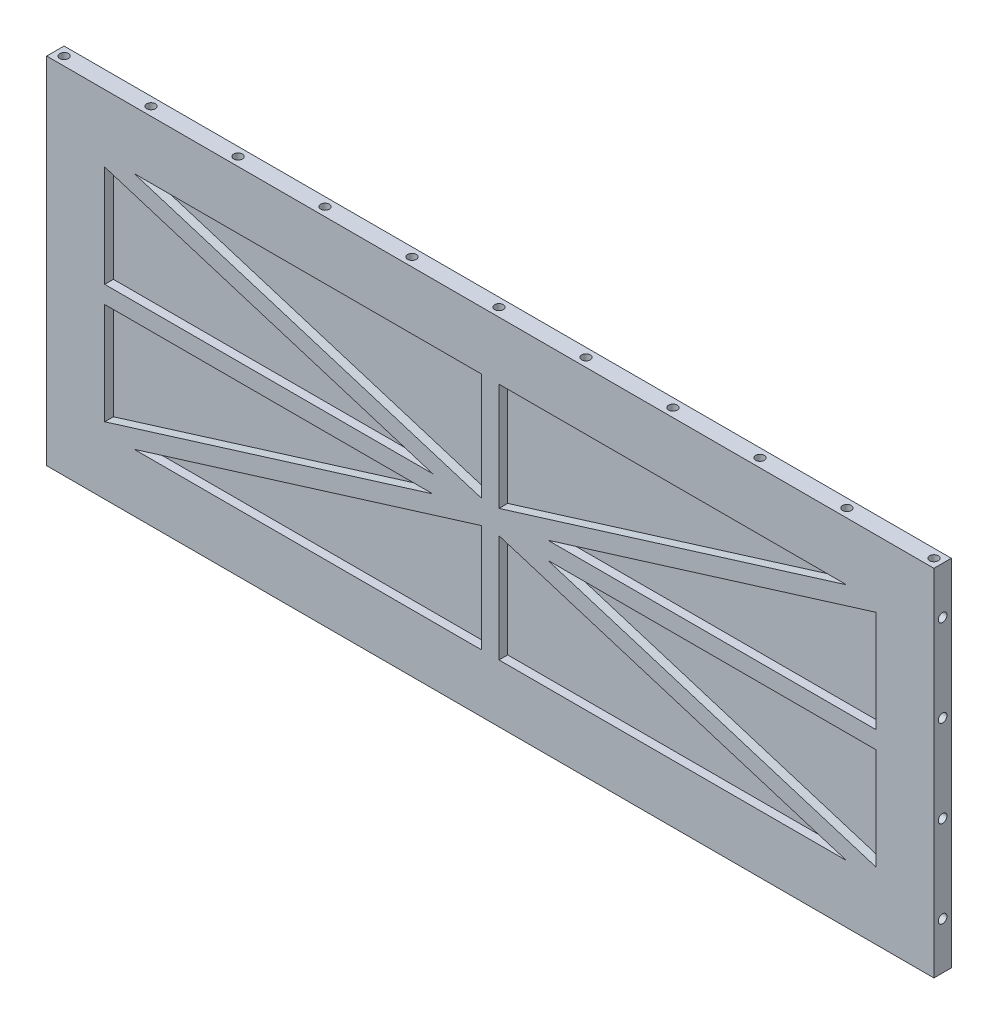
from build123d import *

# Parameters (mm, degrees)
SKETCH_1_W                     = 306
SKETCH_1_H                     = 122.375397488
EXTRUDE_1_DEPTH                = 3
M3X0_5_2_D                     = 2.5
M3X0_5_2_DEPTH                 = 8.5
M3X0_5_2_CBORE_D               = 3
M3X0_5_2_CBORE_DEPTH           = 6
M3X0_5_2_TIP                   = 0.751075774
M3X0_5_2_ON_FACE_2_D           = 2.5
M3X0_5_2_ON_FACE_2_DEPTH       = 8.5
M3X0_5_2_ON_FACE_2_CBORE_D     = 3
M3X0_5_2_ON_FACE_2_CBORE_DEPTH = 6
M3X0_5_2_ON_FACE_2_TIP         = 0.751075774
PATTERN_LINEAR_1_COUNT         = 11
PATTERN_LINEAR_1_PITCH         = 30
CUT_EXTRUDE_1_DEPTH            = 3


# Read off the part's stored shape, not the designer's step: M3x0.5 ねじ穴1
with BuildPart() as part:
    # ｽｹｯﾁ1 → ﾎﾞｽ - 押し出し1 (new, symmetric)
    with BuildSketch(Plane.XY):
        Rectangle(SKETCH_1_W, SKETCH_1_H)
    extrude(amount=EXTRUDE_1_DEPTH, both=True)

    # M3x0.5 ねじ穴1 outline → M3x0.5 ねじ穴1 (revolve, cut)
    with BuildSketch(Plane(origin=(-150, 0, 0), x_dir=(1, 0, 0), z_dir=(0, 0, 1))):
        Polygon((1.25, -52.687698744), (0, -51.93662297), (0, -61.187698744), (1.5, -61.187698744), (1.5, -55.187698744), (1.25, -55.187698744), align=None)
        Polygon((0, 61.187698744), (0, 51.93662297), (1.25, 52.687698744), (1.25, 55.187698744), (1.5, 55.187698744), (1.5, 61.187698744), align=None)
    m3x0_5_1 = revolve(axis=Axis((-150, 0, 0), (0, 1, 0)), mode=Mode.SUBTRACT)

    # M3x0.5 ねじ穴2
    with Locations(Plane(origin=(-153, 45, 0), x_dir=(0, 0, -1), z_dir=(-1, 0, 0))):
        with Locations((0, 0), (0, 30), (0, 60), (0, 90)):
            CounterBoreHole(M3X0_5_2_D / 2, M3X0_5_2_CBORE_D / 2, M3X0_5_2_CBORE_DEPTH, depth=M3X0_5_2_DEPTH)
            with Locations((0, 0, -(M3X0_5_2_DEPTH + M3X0_5_2_TIP / 2))):  # 118° drill point
                Cone(0, M3X0_5_2_D / 2, M3X0_5_2_TIP, mode=Mode.SUBTRACT)

    # M3x0.5 ねじ穴2 on face 2
    with Locations(Plane(origin=(153, -15, 0), x_dir=(0, 0, 1), z_dir=(1, 0, 0))):
        with Locations((0, 0), (0, -30), (0, -60), (0, 30)):
            CounterBoreHole(M3X0_5_2_ON_FACE_2_D / 2, M3X0_5_2_ON_FACE_2_CBORE_D / 2, M3X0_5_2_ON_FACE_2_CBORE_DEPTH, depth=M3X0_5_2_ON_FACE_2_DEPTH)
            with Locations((0, 0, -(M3X0_5_2_ON_FACE_2_DEPTH + M3X0_5_2_ON_FACE_2_TIP / 2))):  # 118° drill point
                Cone(0, M3X0_5_2_ON_FACE_2_D / 2, M3X0_5_2_ON_FACE_2_TIP, mode=Mode.SUBTRACT)

    # 直線ﾊﾟﾀｰﾝ1: M3x0.5 ねじ穴1 ×11
    with Locations(*[(i * PATTERN_LINEAR_1_PITCH, 0, 0) for i in range(1, PATTERN_LINEAR_1_COUNT)]):
        add(m3x0_5_1, mode=Mode.SUBTRACT)

    # ｽｹｯﾁ5 → ｶｯﾄ - 押し出し1 (cut)
    with BuildSketch(Plane.XY.offset(3)):
        Polygon((133, 3), (133, 38.047137303), (19.828606516, 3), align=None)
        Polygon((-3, 41.187698744), (-122.858751899, 41.187698744), (-3, 4.069607278), align=None)
        Polygon((-133, 38.047137303), (-133, 3), (-19.828606516, 3), align=None)
        Polygon((-122.858751899, -41.187698744), (-3, -41.187698744), (-3, -4.069607278), align=None)
        Polygon((133, -38.047137303), (133, -3), (19.828606516, -3), align=None)
        Polygon((122.858751899, 41.187698744), (3, 41.187698744), (3, 4.069607278), align=None)
        Polygon((-133, -3), (-133, -38.047137303), (-19.828606516, -3), align=None)
        Polygon((3, -41.187698744), (122.858751899, -41.187698744), (3, -4.069607278), align=None)
    extrude(amount=-CUT_EXTRUDE_1_DEPTH, mode=Mode.SUBTRACT)


solid = part.part
